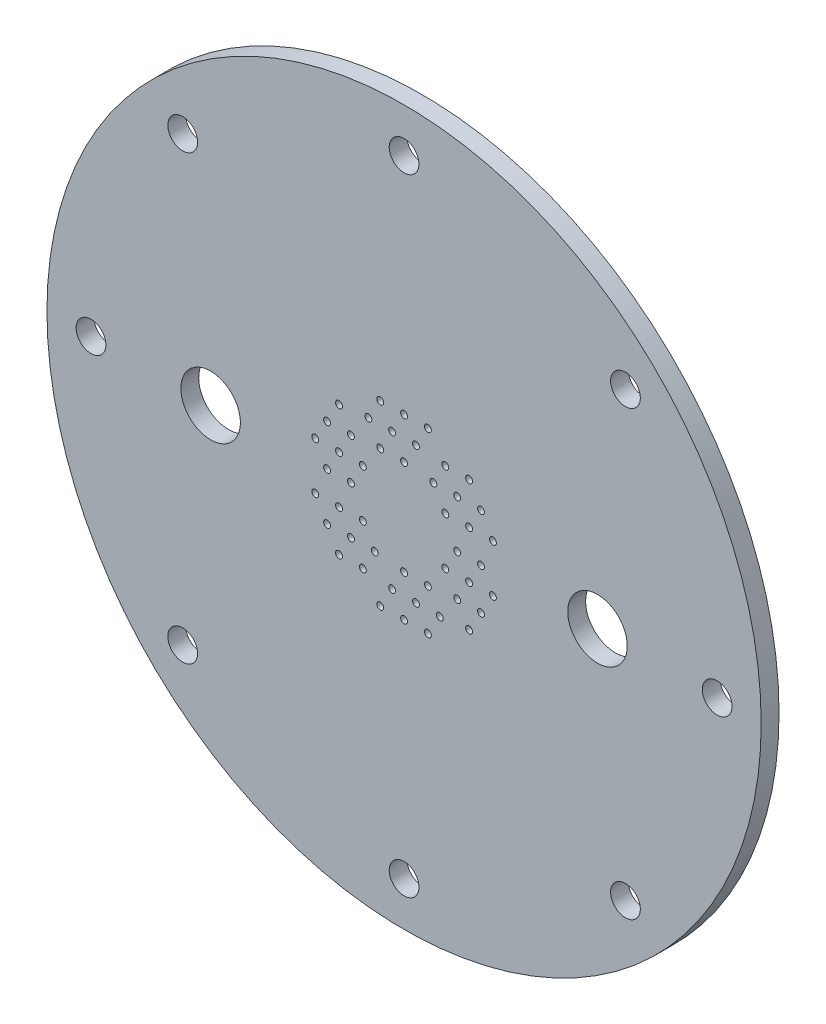
from build123d import *

# Parameters (mm, degrees)
SKETCH1_R           = 76.2
BOSS_EXTRUDE1_DEPTH = 3.81
SKETCH2_R           = 0.7366
CUT_EXTRUDE1_DEPTH  = 108.830404339
CIRPATTERN1_COUNT   = 6
SKETCH3_R           = 6.35
CUT_EXTRUDE2_DEPTH  = 108.830404339
SKETCH5_R           = 3.175
CUT_EXTRUDE3_DEPTH  = 108.830404339
CIRPATTERN2_COUNT   = 8
SKETCH6_W           = 1.27
SKETCH6_H           = 2.54


with BuildPart() as part:
    # Sketch1 → Boss-Extrude1 (new body)
    with BuildSketch(Plane.XY):
        Circle(SKETCH1_R)
    extrude(amount=BOSS_EXTRUDE1_DEPTH)

    # Sketch2 → Cut-Extrude1 (cut, through all)
    with BuildSketch(Plane(origin=(0, 0, 0), x_dir=(-1, 0, 0), z_dir=(0, 0, -1))):
        with Locations((0, 10.16)):
            Circle(SKETCH2_R)
        with Locations((2.54, 14.559409051)):
            Circle(SKETCH2_R)
        with Locations((5.08, 10.16)):
            Circle(SKETCH2_R)
        with Locations((7.62, 14.559409051)):
            Circle(SKETCH2_R)
        with Locations((-2.54, 14.559409051)):
            Circle(SKETCH2_R)
        with Locations((-5.08, 18.958818102)):
            Circle(SKETCH2_R)
        with Locations((0, 18.958818102)):
            Circle(SKETCH2_R)
        with Locations((5.08, 18.958818102)):
            Circle(SKETCH2_R)
    cut_extrude1 = extrude(amount=-CUT_EXTRUDE1_DEPTH, mode=Mode.SUBTRACT)

    # CirPattern1: Cut-Extrude1 ×6 about axis
    cirpattern1_axis = Axis((0, 0, 3.81), (0, 0, -1))
    for i in range(1, CIRPATTERN1_COUNT):
        add(cut_extrude1.rotate(cirpattern1_axis, i * 360 / CIRPATTERN1_COUNT), mode=Mode.SUBTRACT)

    # Sketch3 → Cut-Extrude2 (cut, through all)
    with BuildSketch(Plane(origin=(0, 0, 0), x_dir=(-1, 0, 0), z_dir=(0, 0, -1))):
        with Locations((41.275, 0)):
            Circle(SKETCH3_R)
        with Locations((-41.275, 0)):
            Circle(SKETCH3_R)
    extrude(amount=-CUT_EXTRUDE2_DEPTH, mode=Mode.SUBTRACT)

    # Sketch5 → Cut-Extrude3 (cut, through all)
    with BuildSketch(Plane(origin=(0, 0, 0), x_dir=(-1, 0, 0), z_dir=(0, 0, -1))):
        with Locations((66.802, 0)):
            Circle(SKETCH5_R)
    cut_extrude3 = extrude(amount=-CUT_EXTRUDE3_DEPTH, mode=Mode.SUBTRACT)

    # CirPattern2: Cut-Extrude3 ×8 about axis
    cirpattern2_axis = Axis((0, 0, 3.81), (0, 0, 1))
    for i in range(1, CIRPATTERN2_COUNT):
        add(cut_extrude3.rotate(cirpattern2_axis, i * 360 / CIRPATTERN2_COUNT), mode=Mode.SUBTRACT)

    # Sketch6 → Revolve1 (revolve)
    with BuildSketch(Plane(origin=(0, 0, 0), x_dir=(0, 0, -1), z_dir=(1, 0, 0))):
        with Locations((0.635, 52.07)):
            Rectangle(SKETCH6_W, SKETCH6_H)
    revolve(axis=Axis((0, 0, 0), (0, 0, 1)))


solid = part.part
